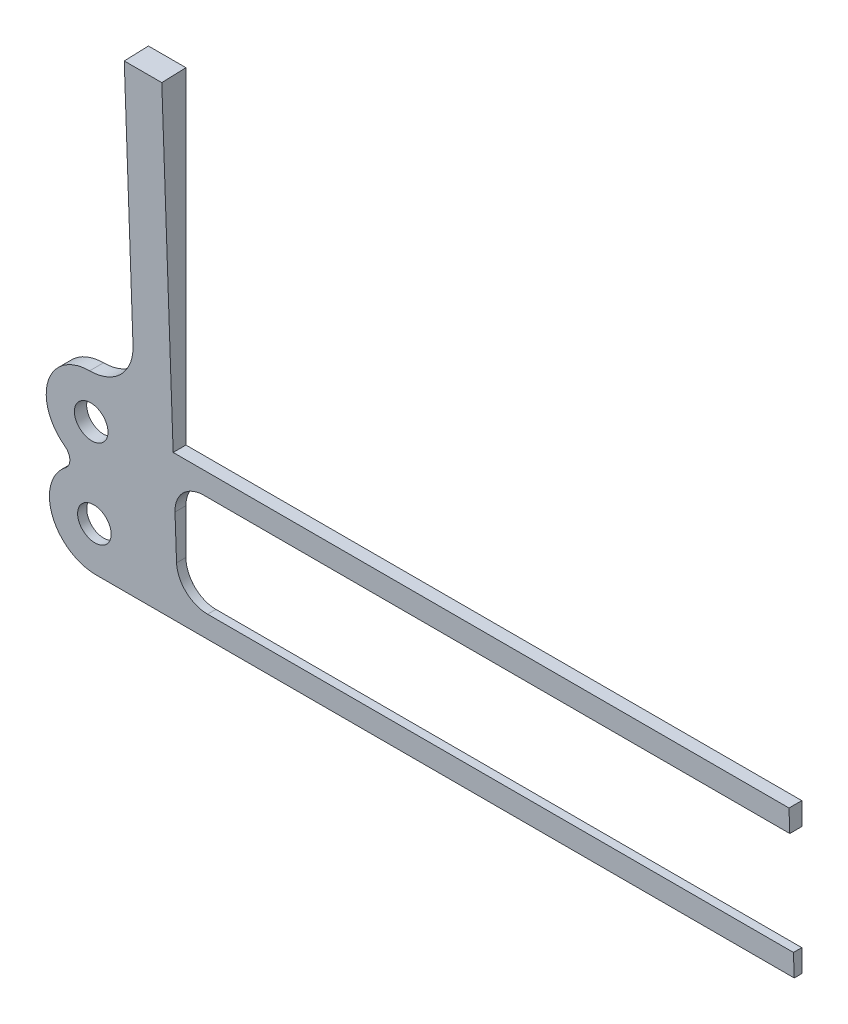
from build123d import *

# Parameters (mm, degrees)
BOSS_EXTRUDE1_OUTLINE_R = 3.556
BOSS_EXTRUDE1_OUTLINE_W = 260.9469
BOSS_EXTRUDE1_OUTLINE_H = 138.1252
BOSS_EXTRUDE1_DEPTH     = 76.2
CUT_EXTRUDE1_DEPTH      = 355.32482824
CUT_EXTRUDE1_DEPTH_BACK = 355.32482824
FILLET1_R               = 2.54
SKETCH7_W               = 260.9469
SKETCH7_H               = 22.1996
CUT_EXTRUDE2_DEPTH      = 347.152897849
FILLET2_R               = 6.35
SKETCH8_W               = 217.439036591
SKETCH8_H               = 235.521960295
CUT_EXTRUDE4_DEPTH      = 347.144751077
SKETCH9_W               = 205.813387363
SKETCH9_H               = 113.418104201
CUT_EXTRUDE5_DEPTH      = 347.144751077


# Read off the part's stored shape, not the designer's step: Boss-Extrude1
with BuildPart() as part:
    # Boss-Extrude1 outline → Boss-Extrude1 (new body)
    with BuildSketch(Plane.XY):
        with BuildLine():
            Line((-286.3596, -22.225), (9.525, -22.225))
            ThreePointArc((9.525, -22.225), (19.05, -12.7), (9.525, -3.175))
            ThreePointArc((9.525, -3.175), (19.05, 6.35), (9.525, 15.875))
            ThreePointArc((9.525, 15.875), (2.789807909, 18.664807909), (0, 25.4))
            Line((0, 25.4), (0, 131.7752))
            ThreePointArc((0, 131.7752), (2.789807909, 138.510392091), (9.525, 141.3002))
            ThreePointArc((9.525, 141.3002), (19.05, 150.8252), (9.525, 160.3502))
            ThreePointArc((9.525, 160.3502), (19.05, 169.8752), (9.525, 179.4002))
            Line((9.525, 179.4002), (-6.35, 179.4002))
            Line((-6.35, 179.4002), (-6.35, 163.5252))
            Line((-6.35, 163.5252), (-7.9502, 163.5252))
            Line((-7.9502, 163.5252), (-7.9502, 160.3502))
            Line((-7.9502, 160.3502), (-268.9098, 160.3502))
            Line((-268.9098, 160.3502), (-268.9098, 163.5252))
            Line((-268.9098, 163.5252), (-270.51, 163.5252))
            Line((-270.51, 163.5252), (-270.51, 179.4002))
            Line((-270.51, 179.4002), (-286.385, 179.4002))
            ThreePointArc((-286.385, 179.4002), (-295.91, 169.8752), (-286.385, 160.3502))
            ThreePointArc((-286.385, 160.3502), (-295.897297883, 150.818850004), (-286.3723, 141.3002))
            ThreePointArc((-286.3723, 141.3002), (-279.637107909, 138.510392091), (-276.8473, 131.7752))
            Line((-276.8473, 131.7752), (-276.8473, 25.4))
            ThreePointArc((-276.8473, 25.4), (-279.637107909, 18.664807909), (-286.3723, 15.875))
            ThreePointArc((-286.3723, 15.875), (-295.8973, 6.35), (-286.3723, -3.175))
            ThreePointArc((-286.3723, -3.175), (-295.884597883, -12.706349996), (-286.3596, -22.225))
        make_face()
        with Locations((-286.3596, -12.7)):
            Circle(BOSS_EXTRUDE1_OUTLINE_R, mode=Mode.SUBTRACT)
        with Locations((-286.3723, 6.35)):
            Circle(BOSS_EXTRUDE1_OUTLINE_R, mode=Mode.SUBTRACT)
        with Locations((9.525, -12.7)):
            Circle(BOSS_EXTRUDE1_OUTLINE_R, mode=Mode.SUBTRACT)
        with Locations((9.525, 6.35)):
            Circle(BOSS_EXTRUDE1_OUTLINE_R, mode=Mode.SUBTRACT)
        with Locations((-286.3723, 150.8252)):
            Circle(BOSS_EXTRUDE1_OUTLINE_R, mode=Mode.SUBTRACT)
        with Locations((-286.385, 169.8752)):
            Circle(BOSS_EXTRUDE1_OUTLINE_R, mode=Mode.SUBTRACT)
        with Locations((-138.42365, 78.5876)):
            Rectangle(BOSS_EXTRUDE1_OUTLINE_W, BOSS_EXTRUDE1_OUTLINE_H, mode=Mode.SUBTRACT)
        with Locations((9.525, 150.8252)):
            Circle(BOSS_EXTRUDE1_OUTLINE_R, mode=Mode.SUBTRACT)
        with Locations((9.525, 169.8752)):
            Circle(BOSS_EXTRUDE1_OUTLINE_R, mode=Mode.SUBTRACT)
    extrude(amount=BOSS_EXTRUDE1_DEPTH)

    # Sketch5 → Cut-Extrude1 (cut, two sides: drawn at the far end of the back side and taken through both)
    with BuildSketch(Plane.ZY.offset(276.8473).offset(-CUT_EXTRUDE1_DEPTH_BACK)):
        Polygon((1.6002, -22.225), (8.641107133, 179.4002), (76.2, 179.4002), (76.2, -22.225), align=None)
    extrude(amount=CUT_EXTRUDE1_DEPTH + CUT_EXTRUDE1_DEPTH_BACK, mode=Mode.SUBTRACT)

    # Fillet1
    fillet1_edges = [part.edges().sort_by_distance(p)[0] for p in [
        (-286.385, 160.3502, 3.987933237),
        (-286.3723, -3.175, 1.132720329),
        (9.525, -3.175, 1.132720329),
        (9.525, 160.3502, 3.987933237),
    ]]
    fillet(fillet1_edges, radius=FILLET1_R)

    # Sketch7 → Cut-Extrude2 (cut, through all)
    with BuildSketch(Plane(origin=(0, 0, 0), x_dir=(-1, 0, 0), z_dir=(0, 0, -1))):
        with Locations((138.42365, -6.35)):
            Rectangle(SKETCH7_W, SKETCH7_H)
    extrude(amount=-CUT_EXTRUDE2_DEPTH, mode=Mode.SUBTRACT)

    # Fillet2
    fillet2_edges = [part.edges().sort_by_distance(p)[0] for p in [
        (-268.8971, 4.7498, 1.271090386),
        (-268.8971, -17.4498, 0.883476829),
        (-7.9502, -17.4498, 0.883476829),
        (-7.9502, 4.7498, 1.271090386),
    ]]
    fillet(fillet2_edges, radius=FILLET2_R)

    # Sketch8 → Cut-Extrude4 (cut, through all)
    with BuildSketch(Plane(origin=(0, -0.082881646, 2.373419811), x_dir=(1, 0, 0), z_dir=(0, -0.03489949670250444, 0.9993908270190958))):
        with Locations((-29.704131704, 74.917246318)):
            Rectangle(SKETCH8_W, SKETCH8_H)
    extrude(amount=-CUT_EXTRUDE4_DEPTH, mode=Mode.SUBTRACT)

    # Sketch9 → Cut-Extrude5 (cut, through all)
    with BuildSketch(Plane(origin=(0, -0.082881646, 2.373419811), x_dir=(1, 0, 0), z_dir=(0, -0.03489949670250444, 0.9993908270190958))):
        with Locations((-241.330343682, 135.427486891)):
            Rectangle(SKETCH9_W, SKETCH9_H)
    extrude(amount=-CUT_EXTRUDE5_DEPTH, mode=Mode.SUBTRACT)


solid = part.part
